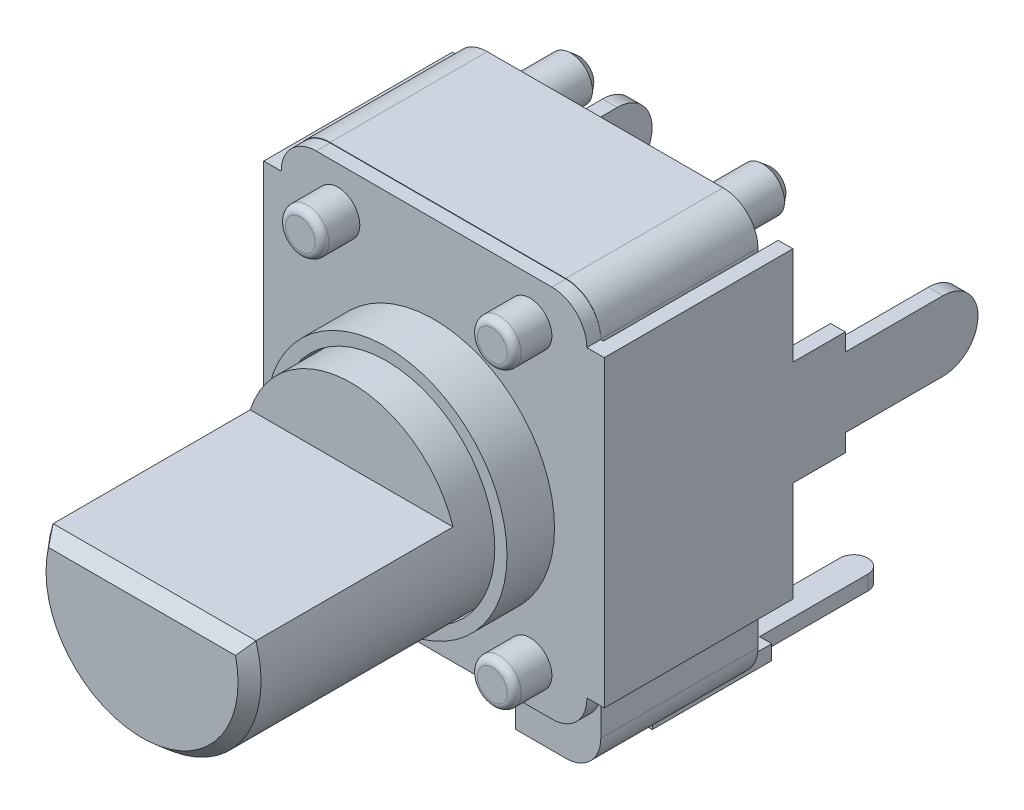
from build123d import *
from OCP.BRepFilletAPI import BRepFilletAPI_MakeChamfer

# Parameters (mm, degrees)
EXTRUSION1_DEPTH        = 4.5
EXTRUSION2_DEPTH        = 1.48
EXTRUSION2_DEPTH_BACK   = 6.5
ESQUISSE3_R             = 0.625
CONG_1_R                = 0.2
CHANFREIN1_SIZE         = 0.2
CHANFREIN1_SIZE2        = 0.238350719
ESQUISSE4_W             = 3.88
ESQUISSE4_H             = 1.2
ENL_V_MAT_EXTRU_1_DEPTH = 1.5
EXTRUSION3_DEPTH        = 0.4
ESQUISSE8_W             = 0.420106654
ESQUISSE8_H             = 8.687057787
EXTRUSION4_DEPTH        = 5
ESQUISSE9_W             = 0.424689677
ESQUISSE9_H             = 1.25
EXTRUSION5_DEPTH        = 2.5
CONG_3_R                = 0.5
CONG_4_R                = 0.5
ESQUISSE11_R            = 3.45
EXTRUSION6_DEPTH        = 1.36
ESQUISSE12_R            = 3.1
ENL_V_MAT_EXTRU_2_DEPTH = 4
ESQUISSE13_R            = 3.05
EXTRUSION7_DEPTH        = 11
ESQUISSE14_W            = 7.136387573
ESQUISSE14_H            = 2.568018255
ENL_V_MAT_EXTRU_7_DEPTH = 6
CHANFREIN2_SIZE         = 0.3
CHANFREIN2_SIZE2        = 0.357526078
ESQUISSE15_W            = 1.5
ESQUISSE15_H            = 0.42
EXTRUSION8_DEPTH        = 0.65
ESQUISSE16_W            = 1.5
ESQUISSE16_H            = 0.42
EXTRUSION9_DEPTH        = 3
ESQUISSE17_W            = 0.8
ESQUISSE17_H            = 0.42
EXTRUSION10_DEPTH       = 3.5
CONG_5_R                = 0.4
ESQUISSE18_W            = 0.420106654
ESQUISSE18_H            = 3
EXTRUSION11_DEPTH       = 1.5
ESQUISSE19_W            = 0.420106654
ESQUISSE19_H            = 2
EXTRUSION12_DEPTH       = 3.8
CONG_6_R                = 1
CONG_3_OF_SYM_TRIE1_R   = 0.5
CONG_4_OF_SYM_TRIE1_R   = 0.5
CONG_6_OF_SYM_TRIE1_R   = 1


with BuildPart() as part:
    # Esquisse2 → Extrusion1 (new body)
    with BuildSketch(Plane.XY):
        with BuildLine():
            Line((-3.375, 5.95), (3.375, 5.95))
            ThreePointArc((3.375, 5.95), (4.082106781, 5.657106781), (4.375, 4.95))
            Line((4.375, 4.95), (4.375, -4.95))
            ThreePointArc((4.375, -4.95), (4.082106781, -5.657106781), (3.375, -5.95))
            Line((3.375, -5.95), (-3.375, -5.95))
            ThreePointArc((-3.375, -5.95), (-4.082106781, -5.657106781), (-4.375, -4.95))
            Line((-4.375, -4.95), (-4.375, 4.95))
            ThreePointArc((-4.375, 4.95), (-4.082106781, 5.657106781), (-3.375, 5.95))
        make_face()
    extrude(amount=EXTRUSION1_DEPTH)

    # Esquisse3 → Extrusion2 (add, two sides: drawn at the far end of the back side and taken through both)
    with BuildSketch(Plane.XY.offset(4.5).offset(-EXTRUSION2_DEPTH_BACK)):
        with Locations((-2.75, 4.725)):
            Circle(ESQUISSE3_R)
        with Locations((2.75, 4.725)):
            Circle(ESQUISSE3_R)
        with Locations((2.75, -3.695)):
            Circle(ESQUISSE3_R)
        with Locations((-2.75, -3.695)):
            Circle(ESQUISSE3_R)
    extrude(amount=EXTRUSION2_DEPTH + EXTRUSION2_DEPTH_BACK)

    # Congé1
    cong_1_edges = [part.edges().sort_by_distance(p)[0] for p in [
        (-3.375, 4.725, 5.98),
        (2.125, 4.725, 5.98),
        (2.125, -3.695, 5.98),
        (-3.375, -3.695, 5.98),
    ]]
    fillet(cong_1_edges, radius=CONG_1_R)

    # Chanfrein1: one chamfer whose edges measure the first distance from different faces: ONE call of the kernel's chamfer builder (chamfer() names one face for all edges)
    chanfrein1_edges_1 = [part.edges().sort_by_distance(p)[0] for p in [
        (-3.375, 4.725, -2),
    ]]
    chanfrein1_side_1 = [part.faces().sort_by_distance(p)[0] for p in [
        (-2.75, 4.725, -2),
    ]]
    chanfrein1_edges_2 = [part.edges().sort_by_distance(p)[0] for p in [
        (2.125, 4.725, -2),
    ]]
    chanfrein1_side_2 = [part.faces().sort_by_distance(p)[0] for p in [
        (2.75, 4.725, -2),
    ]]
    chanfrein1_edges_3 = [part.edges().sort_by_distance(p)[0] for p in [
        (2.125, -3.695, -2),
    ]]
    chanfrein1_side_3 = [part.faces().sort_by_distance(p)[0] for p in [
        (2.75, -3.695, -2),
    ]]
    chanfrein1_edges_4 = [part.edges().sort_by_distance(p)[0] for p in [
        (-3.375, -3.695, -2),
    ]]
    chanfrein1_side_4 = [part.faces().sort_by_distance(p)[0] for p in [
        (-2.75, -3.695, -2),
    ]]
    chanfrein1 = BRepFilletAPI_MakeChamfer(part.part.solid().wrapped)
    for e in chanfrein1_edges_1:
        chanfrein1.Add(CHANFREIN1_SIZE, CHANFREIN1_SIZE2, e.wrapped, chanfrein1_side_1[0].wrapped)  # the first distance lies on this face
    for e in chanfrein1_edges_2:
        chanfrein1.Add(CHANFREIN1_SIZE, CHANFREIN1_SIZE2, e.wrapped, chanfrein1_side_2[0].wrapped)  # the first distance lies on this face
    for e in chanfrein1_edges_3:
        chanfrein1.Add(CHANFREIN1_SIZE, CHANFREIN1_SIZE2, e.wrapped, chanfrein1_side_3[0].wrapped)  # the first distance lies on this face
    for e in chanfrein1_edges_4:
        chanfrein1.Add(CHANFREIN1_SIZE, CHANFREIN1_SIZE2, e.wrapped, chanfrein1_side_4[0].wrapped)  # the first distance lies on this face
    add(Compound.cast(chanfrein1.Shape()), mode=Mode.REPLACE)

    # Esquisse4 → Enlèv. mat.-Extru.1 (cut)
    with BuildSketch(Plane.XY.offset(4.5)):
        with Locations((0, -5.35)):
            Rectangle(ESQUISSE4_W, ESQUISSE4_H)
    extrude(amount=-ENL_V_MAT_EXTRU_1_DEPTH, mode=Mode.SUBTRACT)

    # Esquisse5 → Extrusion3 (add)
    with BuildSketch(Plane.XY.offset(4.5)):
        with BuildLine():
            Line((-3.375865226, 5.937057787), (0, 5.937057787))
            Line((0, 5.937057787), (0, -4.775009367))
            Line((0, -4.775009367), (-3.376178009, -4.775009367))
            ThreePointArc((-3.376178009, -4.775009367), (-4.092072333, -4.473218015), (-4.375865226, -3.75))
            Line((-4.375865226, -3.75), (-4.875865226, -3.75))
            Line((-4.875865226, -3.75), (-4.875865226, 4.937057787))
            Line((-4.875865226, 4.937057787), (-4.375865226, 4.937057787))
            ThreePointArc((-4.375865226, 4.937057787), (-4.082972007, 5.644164569), (-3.375865226, 5.937057787))
        make_face()
    extrusion3 = extrude(amount=EXTRUSION3_DEPTH)

    # Esquisse8 → Extrusion4 (add)
    with BuildSketch(Plane(origin=(0, 0, 4.5), x_dir=(-1, 0, 0), z_dir=(0, 0, -1))):
        with Locations((4.665811899, 0.593528894)):
            Rectangle(ESQUISSE8_W, ESQUISSE8_H)
    extrusion4 = extrude(amount=EXTRUSION4_DEPTH)

    # Esquisse9 → Extrusion5 (add)
    with BuildSketch(Plane(origin=(-4.455758572, 0, 0), x_dir=(0, 0, -1), z_dir=(1, 0, 0))):
        with Locations((0.283831247, -2.075)):
            Rectangle(ESQUISSE9_W, ESQUISSE9_H)
        with Locations((0.284099775, 3.325)):
            Rectangle(ESQUISSE9_W, ESQUISSE9_H)
    extrusion5 = extrude(amount=EXTRUSION5_DEPTH)

    # Congé3
    cong_3_edges = [part.edges().sort_by_distance(p)[0] for p in [
        (-1.955758572, -1.45, -0.283831246),
        (-1.955758572, -2.7, -0.283831246),
    ]]
    fillet(cong_3_edges, radius=CONG_3_R)

    # Congé4
    cong_4_edges = [part.edges().sort_by_distance(p)[0] for p in [
        (-1.955758572, 3.95, -0.284099776),
        (-1.955758572, 2.7, -0.284099776),
    ]]
    fillet(cong_4_edges, radius=CONG_4_R)

    # Esquisse11 → Extrusion6 (add)
    with BuildSketch(Plane.XY.offset(4.9)):
        with Locations(Location((0, 0, 0), (0, 0, 270))):
            Circle(ESQUISSE11_R)
    extrude(amount=EXTRUSION6_DEPTH)

    # Esquisse12 → Enlèv. mat.-Extru.2 (cut)
    with BuildSketch(Plane.XY.offset(6.26)):
        Circle(ESQUISSE12_R)
    extrude(amount=-ENL_V_MAT_EXTRU_2_DEPTH, mode=Mode.SUBTRACT)

    # Esquisse13 → Extrusion7 (add)
    with BuildSketch(Plane.XY.offset(2.26)):
        Circle(ESQUISSE13_R)
    extrude(amount=EXTRUSION7_DEPTH)

    # Esquisse14 → Enlèv. mat.-Extru.7 (cut)
    with BuildSketch(Plane.XY.offset(13.26)):
        with Locations((0.012650659, 2.216605231)):
            Rectangle(ESQUISSE14_W, ESQUISSE14_H)
    extrude(amount=-ENL_V_MAT_EXTRU_7_DEPTH, mode=Mode.SUBTRACT)

    # Chanfrein2
    chanfrein2_edges = [part.edges().sort_by_distance(p)[0] for p in [
        (-0.471983632, -3.013259274, 13.26),
        (0, 0.932596103, 13.26),
    ]]
    chanfrein2_side = [part.faces().sort_by_distance(p)[0] for p in [
        (0, -0.80773857, 13.26),
    ]]
    chamfer(chanfrein2_edges, length=CHANFREIN2_SIZE, length2=CHANFREIN2_SIZE2, reference=chanfrein2_side[0])

    # Esquisse15 → Extrusion8 (add)
    with BuildSketch(Plane.XZ.offset(5.95)):
        with Locations((0, 1.69)):
            Rectangle(ESQUISSE15_W, ESQUISSE15_H)
        with Locations((2.5, 1.69)):
            Rectangle(ESQUISSE15_W, ESQUISSE15_H)
        with Locations((-2.5, 1.69)):
            Rectangle(ESQUISSE15_W, ESQUISSE15_H)
    extrude(amount=EXTRUSION8_DEPTH)

    # Esquisse16 → Extrusion9 (add)
    with BuildSketch(Plane(origin=(0, 0, 1.48), x_dir=(-1, 0, 0), z_dir=(0, 0, -1))):
        with Locations((2.5, -6.39)):
            Rectangle(ESQUISSE16_W, ESQUISSE16_H)
        with Locations((0, -6.39)):
            Rectangle(ESQUISSE16_W, ESQUISSE16_H)
        with Locations((-2.5, -6.39)):
            Rectangle(ESQUISSE16_W, ESQUISSE16_H)
    extrude(amount=EXTRUSION9_DEPTH)

    # Esquisse17 → Extrusion10 (add)
    with BuildSketch(Plane(origin=(0, 0, -1.52), x_dir=(-1, 0, 0), z_dir=(0, 0, -1))):
        with Locations((2.5, -6.39)):
            Rectangle(ESQUISSE17_W, ESQUISSE17_H)
        with Locations((0, -6.39)):
            Rectangle(ESQUISSE17_W, ESQUISSE17_H)
        with Locations((-2.5, -6.39)):
            Rectangle(ESQUISSE17_W, ESQUISSE17_H)
    extrude(amount=EXTRUSION10_DEPTH)

    # Congé5
    cong_5_edges = [part.edges().sort_by_distance(p)[0] for p in [
        (2.9, -6.39, -5.02),
        (-2.1, -6.39, -5.02),
        (0.4, -6.39, -5.02),
        (-2.9, -6.39, -5.02),
        (-0.4, -6.39, -5.02),
        (2.1, -6.39, -5.02),
    ]]
    fillet(cong_5_edges, radius=CONG_5_R - 0.0001)  # a hair under: the kernel refuses the full size

    # Esquisse18 → Extrusion11 (add)
    with BuildSketch(Plane(origin=(0, 0, -0.5), x_dir=(-1, 0, 0), z_dir=(0, 0, -1))):
        with Locations((4.665811899, 0.625)):
            Rectangle(ESQUISSE18_W, ESQUISSE18_H)
    extrusion11 = extrude(amount=EXTRUSION11_DEPTH)

    # Esquisse19 → Extrusion12 (add)
    with BuildSketch(Plane(origin=(0, 0, -2), x_dir=(-1, 0, 0), z_dir=(0, 0, -1))):
        with Locations((4.665811899, 0.625)):
            Rectangle(ESQUISSE19_W, ESQUISSE19_H)
    extrusion12 = extrude(amount=EXTRUSION12_DEPTH)

    # Congé6
    cong_6_edges = [part.edges().sort_by_distance(p)[0] for p in [
        (-4.665811899, -0.375, -5.8),
        (-4.665811899, 1.625, -5.8),
    ]]
    fillet(cong_6_edges, radius=CONG_6_R - 0.0001)  # a hair under: the kernel refuses the full size

    # Symétrie1: Extrusion3, Extrusion4, Extrusion5, Extrusion11, Extrusion12 across Right Plane
    add(extrusion3.mirror(Plane(origin=(0, 0, 0), x_dir=(0, 0, -1), z_dir=(1, 0, 0))))
    add(extrusion4.mirror(Plane(origin=(0, 0, 0), x_dir=(0, 0, -1), z_dir=(1, 0, 0))))
    add(extrusion5.mirror(Plane(origin=(0, 0, 0), x_dir=(0, 0, -1), z_dir=(1, 0, 0))))
    add(extrusion11.mirror(Plane(origin=(0, 0, 0), x_dir=(0, 0, -1), z_dir=(1, 0, 0))))
    add(extrusion12.mirror(Plane(origin=(0, 0, 0), x_dir=(0, 0, -1), z_dir=(1, 0, 0))))

    # Congé3 of Symétrie1
    cong_3_of_sym_trie1_edges = [part.edges().sort_by_distance(p)[0] for p in [
        (1.955758572, -1.45, -0.283831246),
        (1.955758572, -2.7, -0.283831246),
    ]]
    fillet(cong_3_of_sym_trie1_edges, radius=CONG_3_OF_SYM_TRIE1_R)

    # Congé4 of Symétrie1
    cong_4_of_sym_trie1_edges = [part.edges().sort_by_distance(p)[0] for p in [
        (1.955758572, 3.95, -0.284099776),
        (1.955758572, 2.7, -0.284099776),
    ]]
    fillet(cong_4_of_sym_trie1_edges, radius=CONG_4_OF_SYM_TRIE1_R)

    # Congé6 of Symétrie1
    cong_6_of_sym_trie1_edges = [part.edges().sort_by_distance(p)[0] for p in [
        (4.665811899, -0.375, -5.8),
        (4.665811899, 1.625, -5.8),
    ]]
    fillet(cong_6_of_sym_trie1_edges, radius=CONG_6_OF_SYM_TRIE1_R - 0.0001)  # a hair under: the kernel refuses the full size


solid = part.part
